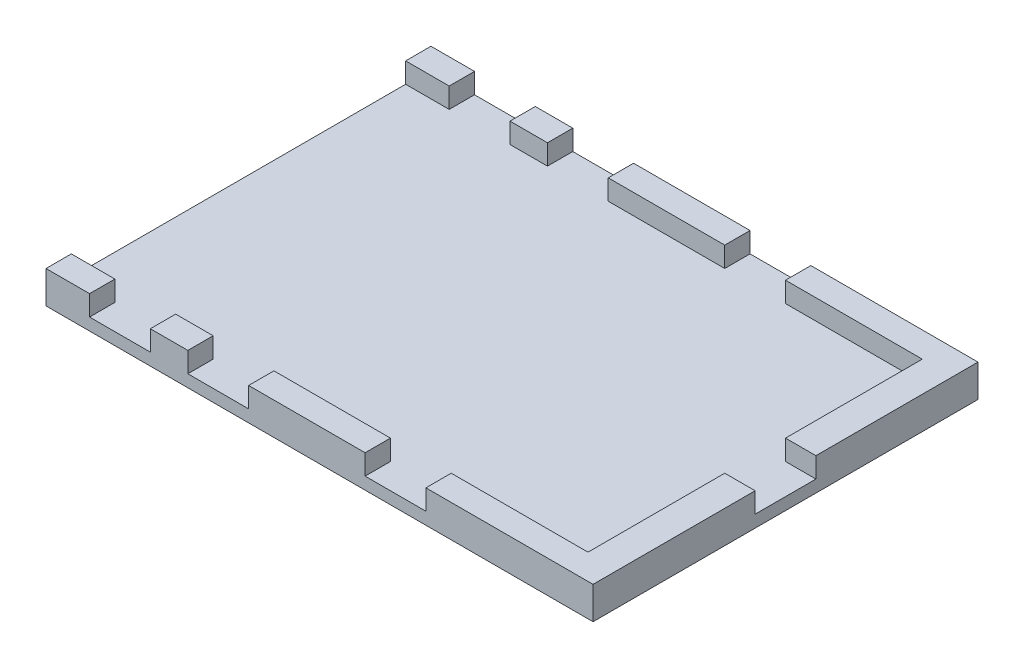
from build123d import *

# Parameters (mm, degrees)
SKETCH1_W           = 54
SKETCH1_H           = 38
BOSS_EXTRUDE1_DEPTH = 1.2
SKETCH3_W           = 4.3
SKETCH3_H           = 2.5
SKETCH3_W_2         = 3.7
SKETCH3_W_3         = 11.5
BOSS_EXTRUDE2_DEPTH = 2


with BuildPart() as part:
    # Sketch1 → Boss-Extrude1 (new body)
    with BuildSketch(Plane(origin=(0, 0, 0), x_dir=(1, 0, 0), z_dir=(0, 1, 0))):
        Rectangle(SKETCH1_W, SKETCH1_H)
    extrude(amount=BOSS_EXTRUDE1_DEPTH)

    # Sketch3 → Boss-Extrude2 (add)
    with BuildSketch(Plane(origin=(0, 1.2, 0), x_dir=(1, 0, 0), z_dir=(0, 1, 0))):
        with Locations((-24.85, -17.75)):
            Rectangle(SKETCH3_W, SKETCH3_H)
        with Locations((-14.85, -17.75)):
            Rectangle(SKETCH3_W_2, SKETCH3_H)
        with Locations((-1.25, -17.75)):
            Rectangle(SKETCH3_W_3, SKETCH3_H)
        Polygon((10.5, -16.5), (10.5, -19), (27, -19), (27, -3), (24, -3), (24, -16.5), align=None)
        Polygon((24, 3), (27, 3), (27, 19), (10.5, 19), (10.5, 16.5), (24, 16.5), align=None)
        with Locations((-1.25, 17.75)):
            Rectangle(SKETCH3_W_3, SKETCH3_H)
        with Locations((-14.85, 17.75)):
            Rectangle(SKETCH3_W_2, SKETCH3_H)
        with Locations((-24.85, 17.75)):
            Rectangle(SKETCH3_W, SKETCH3_H)
    extrude(amount=BOSS_EXTRUDE2_DEPTH)


solid = part.part
